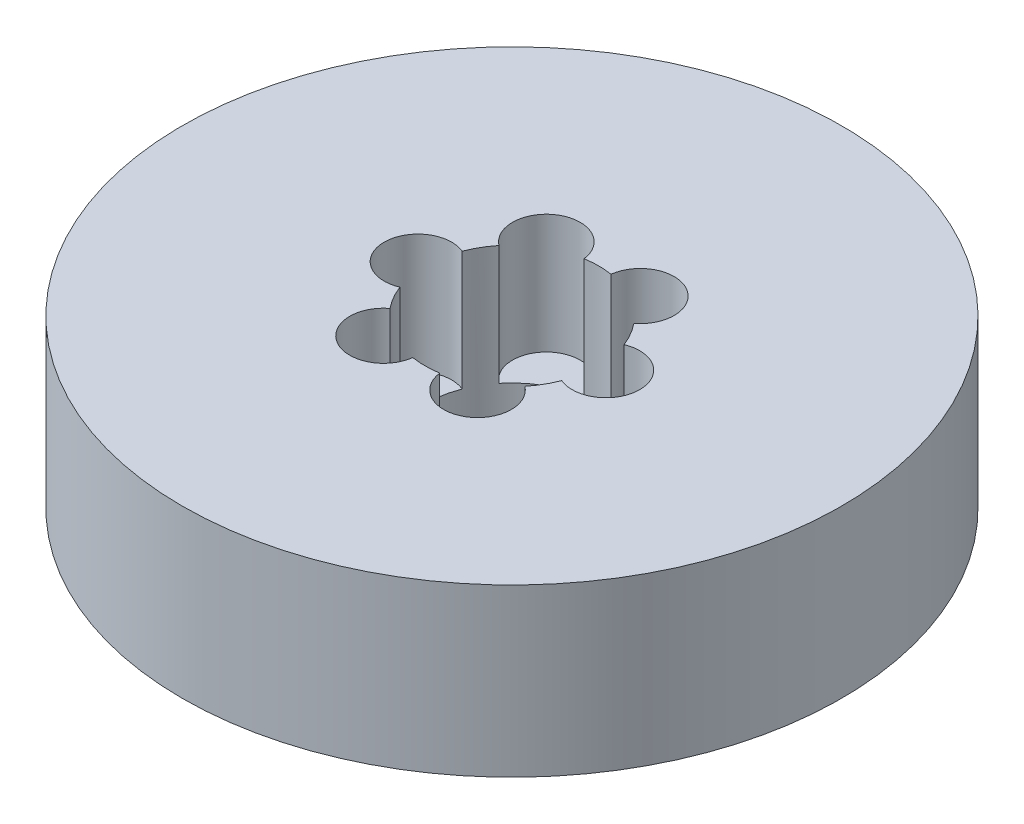
from build123d import *

# Parameters (mm, degrees)
SKETCH1_R           = 47.5
BOSS_EXTRUDE1_DEPTH = 24
SKETCH2_R           = 12.5
CUT_EXTRUDE1_DEPTH  = 72.33372274
SKETCH3_R           = 4.87207621
CUT_EXTRUDE2_DEPTH  = 17.204463713
CIRPATTERN1_COUNT   = 6


with BuildPart() as part:
    # Sketch1 → Boss-Extrude1 (new body)
    with BuildSketch(Plane(origin=(0, 0, 0), x_dir=(1, 0, 0), z_dir=(0, 1, 0))):
        Circle(SKETCH1_R)
    extrude(amount=BOSS_EXTRUDE1_DEPTH)

    # Sketch2 → Cut-Extrude1 (cut, through all)
    with BuildSketch(Plane(origin=(0, 0, 0), x_dir=(1, 0, 0), z_dir=(0, 1, 0))):
        Circle(SKETCH2_R)
    extrude(amount=CUT_EXTRUDE1_DEPTH, mode=Mode.SUBTRACT)

    # Sketch3 → Cut-Extrude2 (cut)
    with BuildSketch(Plane(origin=(0, 24, 0), x_dir=(1, 0, 0), z_dir=(0, 1, 0))):
        with Locations((-13.546828855, 0)):
            Circle(SKETCH3_R)
    cut_extrude2 = extrude(amount=-CUT_EXTRUDE2_DEPTH, mode=Mode.SUBTRACT)

    # CirPattern1: Cut-Extrude2 ×6 about axis
    cirpattern1_axis = Axis((0, 0, 0), (0, 1, 0))
    for i in range(1, CIRPATTERN1_COUNT):
        add(cut_extrude2.rotate(cirpattern1_axis, i * 360 / CIRPATTERN1_COUNT), mode=Mode.SUBTRACT)


solid = part.part
